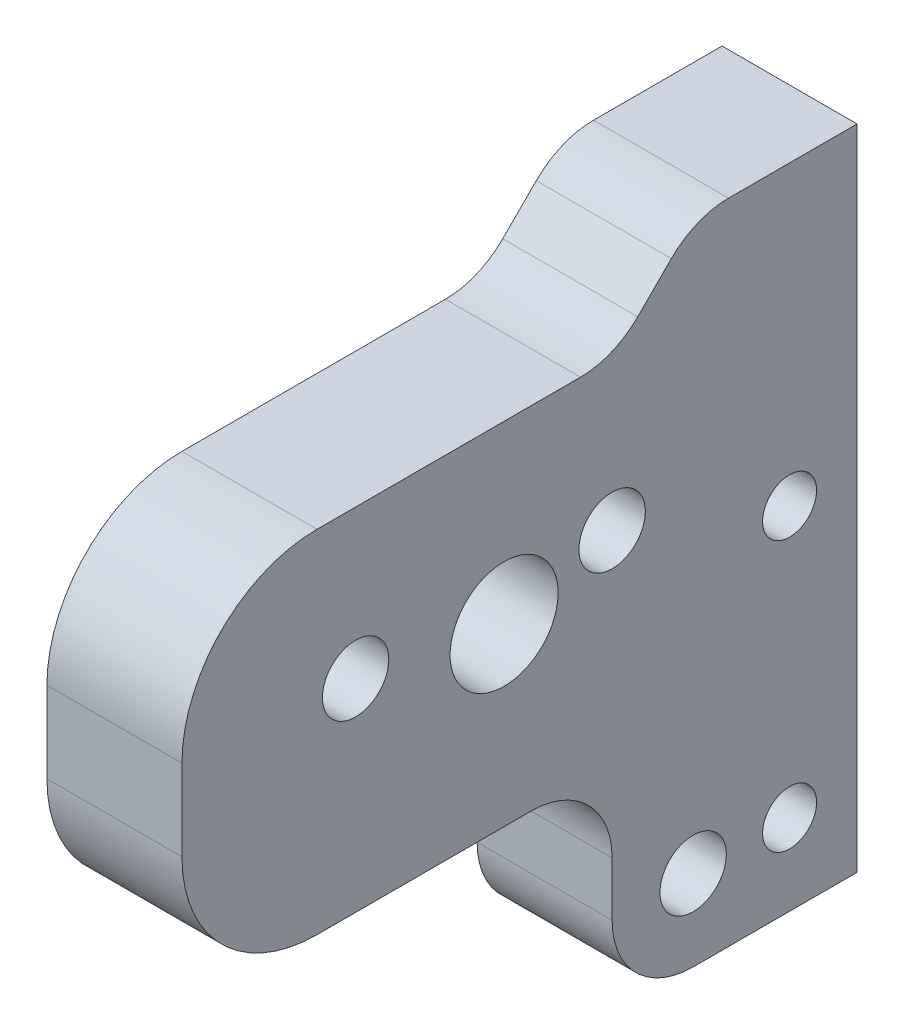
from build123d import *

# Parameters (mm, degrees)
SKETCH1_R           = 1.2295
SKETCH1_R_2         = 2
SKETCH1_R_3         = 1
BOSS_EXTRUDE1_DEPTH = 5
SKETCH2_R           = 1.25
CUT_EXTRUDE1_DEPTH  = 5
FILLET1_R           = 5


with BuildPart() as part:
    # Sketch1 → Boss-Extrude1 (new body)
    with BuildSketch(Plane.YZ):
        with BuildLine():
            Line((-11.729138766, -13.432284692), (-11.729138766, -7.362284692))
            ThreePointArc((-11.729138766, -7.362284692), (-10.85045911, -5.240964348), (-8.729138766, -4.362284692))
            Line((-8.729138766, -4.362284692), (-6.729138766, -4.362284692))
            ThreePointArc((-6.729138766, -4.362284692), (-4.607818422, -3.483605035), (-3.729138766, -1.362284692))
            Line((-3.729138766, -1.362284692), (-3.729138766, 11.567715308))
            Line((-3.729138766, 11.567715308), (9.270861234, 11.567715308))
            Line((9.270861234, 11.567715308), (9.270861234, 8.567715308))
            Line((9.270861234, 8.567715308), (9.270861234, -3.189644004))
            ThreePointArc((9.270861234, -3.189644004), (9.499222636, -4.337694301), (10.14954089, -5.310964348))
            Line((10.14954089, -5.310964348), (11.392181578, -6.553605035))
            ThreePointArc((11.392181578, -6.553605035), (12.042499832, -7.526875082), (12.270861234, -8.674925379))
            Line((12.270861234, -8.674925379), (12.270861234, -13.432284692))
            Line((12.270861234, -13.432284692), (-11.729138766, -13.432284692))
        make_face()
        with Locations((3.770861234, 5.137715308)):
            Circle(SKETCH1_R, mode=Mode.SUBTRACT)
        with Locations((2.770861234, -0.362284692)):
            Circle(SKETCH1_R_2, mode=Mode.SUBTRACT)
        with Locations((3.770861234, -4.362284692)):
            Circle(SKETCH1_R, mode=Mode.SUBTRACT)
        with Locations((-8.729138766, -7.362284692)):
            Circle(SKETCH1_R, mode=Mode.SUBTRACT)
        with Locations((-8.729138766, -10.932284692)):
            Circle(SKETCH1_R_3, mode=Mode.SUBTRACT)
        with Locations((1.270861234, -10.932284692)):
            Circle(SKETCH1_R_3, mode=Mode.SUBTRACT)
    extrude(amount=BOSS_EXTRUDE1_DEPTH)

    # Sketch2 → Cut-Extrude1 (cut)
    with BuildSketch(Plane(origin=(0, 0, -13.432284692), x_dir=(1, 0, 0), z_dir=(0, 0, -1))):
        with Locations((2.5, -8.770861234)):
            Circle(SKETCH2_R)
        with Locations((2.5, 5.229138766)):
            Circle(SKETCH2_R)
    extrude(amount=-CUT_EXTRUDE1_DEPTH, mode=Mode.SUBTRACT)

    # Fillet1
    fillet1_edges = [part.edges().sort_by_distance(p)[0] for p in [
        (2.5, 9.270861234, 11.567715308),
        (2.5, -3.729138766, 11.567715308),
    ]]
    fillet(fillet1_edges, radius=FILLET1_R)


solid = part.part
